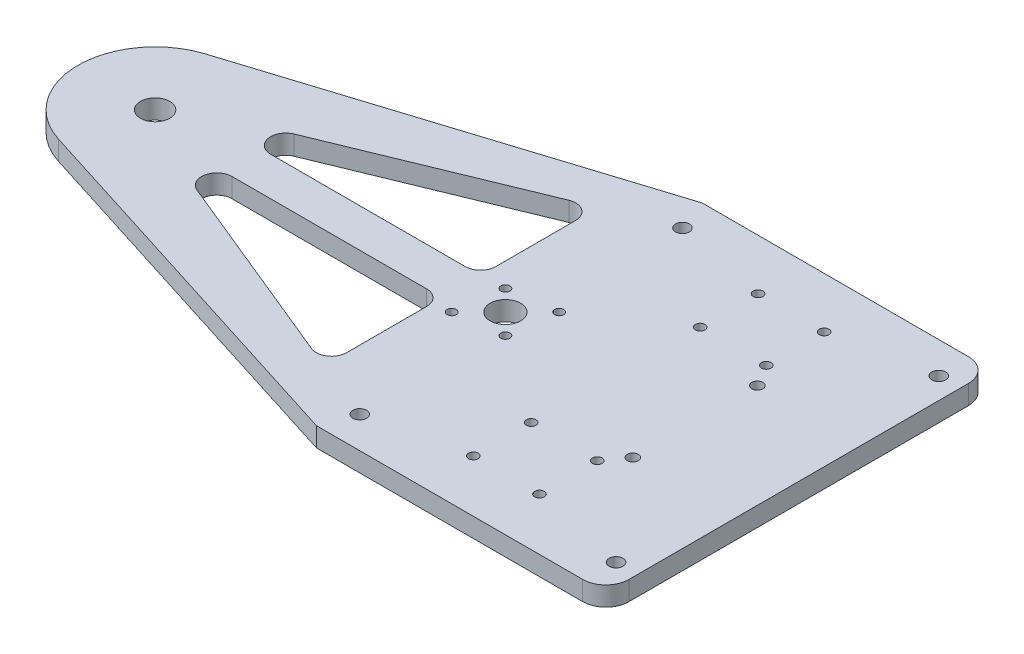
from build123d import *

# Parameters (mm, degrees)
SKETCH1_W           = 95.25
SKETCH1_H           = 127
BOSS_EXTRUDE1_DEPTH = 6.35
BOSS_EXTRUDE3_DEPTH = 6.35
SKETCH5_R           = 4.826
SKETCH5_R_2         = 5.039999953
SKETCH5_R_3         = 1.5
CUT_EXTRUDE1_DEPTH  = 201.11039673
CUT_EXTRUDE2_DEPTH  = 201.11039673
FILLET9_R           = 5
FILLET10_R          = 7.62
SKETCH7_R           = 2.2812375
CUT_EXTRUDE3_DEPTH  = 201.11039673
SKETCH8_R           = 1.5875
CUT_EXTRUDE4_DEPTH  = 201.11039673
SKETCH9_R           = 1.830008083
CUT_EXTRUDE5_DEPTH  = 201.11039673


with BuildPart() as part:
    # Sketch1 → Boss-Extrude1 (new body)
    with BuildSketch(Plane(origin=(0, 0, 0), x_dir=(1, 0, 0), z_dir=(0, 1, 0))):
        Rectangle(SKETCH1_W, SKETCH1_H)
    extrude(amount=BOSS_EXTRUDE1_DEPTH)

    # Sketch4 → Boss-Extrude3 (add)
    with BuildSketch(Plane(origin=(0, 6.35, 0), x_dir=(1, 0, 0), z_dir=(0, 1, 0))):
        with BuildLine():
            Line((-47.625, 63.5), (-171.916018217, 24.219268021))
            ThreePointArc((-171.916018217, 24.219268021), (-189.6618, 0), (-171.916018217, -24.219268021))
            Line((-171.916018217, -24.219268021), (-47.625, -63.5))
            Line((-47.625, -63.5), (-47.625, 63.5))
        make_face()
    extrude(amount=-BOSS_EXTRUDE3_DEPTH)

    # Sketch5 → Cut-Extrude1 (cut, through all)
    with BuildSketch(Plane(origin=(0, 6.35, 0), x_dir=(1, 0, 0), z_dir=(0, 1, 0))):
        with Locations((-164.2618, 0)):
            Circle(SKETCH5_R)
        with Locations((-48.9458, 0)):
            Circle(SKETCH5_R_2)
        with Locations((-42.228285579, -6.717514421)):
            Circle(SKETCH5_R_3)
        with Locations((-40.106965235, 8.838834765)):
            Circle(SKETCH5_R_3)
        with Locations((-57.784634765, -8.838834765)):
            Circle(SKETCH5_R_3)
        with Locations((-55.663314421, 6.717514421)):
            Circle(SKETCH5_R_3)
    extrude(amount=-CUT_EXTRUDE1_DEPTH, mode=Mode.SUBTRACT)

    # Sketch6 → Cut-Extrude2 (cut, through all)
    with BuildSketch(Plane(origin=(0, 6.35, 0), x_dir=(1, 0, 0), z_dir=(0, 1, 0))):
        Polygon((-63.5, 45.163743355), (-157.9118, 6.35), (-63.5, 6.35), align=None)
        Polygon((-63.5, -6.35), (-63.5, -45.163743355), (-157.9118, -6.35), align=None)
    extrude(amount=-CUT_EXTRUDE2_DEPTH, mode=Mode.SUBTRACT)

    # Fillet9
    fillet9_edges = [part.edges().sort_by_distance(p)[0] for p in [
        (-157.9118, 3.175, 6.35),
        (-63.5, 3.175, 6.35),
        (-63.5, 3.175, 45.163743355),
        (-63.5, 3.175, -6.35),
        (-157.9118, 3.175, -6.35),
        (-63.5, 3.175, -45.163743355),
    ]]
    fillet(fillet9_edges, radius=FILLET9_R)

    # Fillet10
    fillet10_edges = [part.edges().sort_by_distance(p)[0] for p in [
        (47.625, 3.175, -63.5),
        (47.625, 3.175, 63.5),
    ]]
    fillet(fillet10_edges, radius=FILLET10_R)

    # Sketch7 → Cut-Extrude3 (cut, through all)
    with BuildSketch(Plane(origin=(0, 6.35, 0), x_dir=(1, 0, 0), z_dir=(0, 1, 0))):
        with Locations((-43.777254611, -53.125383493)):
            Circle(SKETCH7_R)
        with Locations((-43.777254611, 53.125383493)):
            Circle(SKETCH7_R)
        with Locations((40.602254611, 53.125383493)):
            Circle(SKETCH7_R)
        with Locations((40.602254611, -53.125383493)):
            Circle(SKETCH7_R)
    extrude(amount=-CUT_EXTRUDE3_DEPTH, mode=Mode.SUBTRACT)

    # Sketch8 → Cut-Extrude4 (cut, through all)
    with BuildSketch(Plane(origin=(0, 6.35, 0), x_dir=(1, 0, 0), z_dir=(0, 1, 0))):
        with Locations((-13.209796215, -27.25)):
            Circle(SKETCH8_R)
        with Locations((8.564628211, -27.25)):
            Circle(SKETCH8_R)
        with Locations((8.564628211, -46.3)):
            Circle(SKETCH8_R)
        with Locations((-13.209796215, -46.3)):
            Circle(SKETCH8_R)
        with Locations((9.199628211, 46.8)):
            Circle(SKETCH8_R)
        with Locations((-12.574796215, 27.75)):
            Circle(SKETCH8_R)
        with Locations((-12.574796215, 46.8)):
            Circle(SKETCH8_R)
        with Locations((9.199628211, 27.75)):
            Circle(SKETCH8_R)
    extrude(amount=-CUT_EXTRUDE4_DEPTH, mode=Mode.SUBTRACT)

    # Sketch9 → Cut-Extrude5 (cut, through all)
    with BuildSketch(Plane(origin=(0, 6.35, 0), x_dir=(1, 0, 0), z_dir=(0, 1, 0))):
        with Locations((13.499388849, -20.49783886)):
            Circle(SKETCH9_R)
        with Locations((13.49951585, 20.502576943)):
            Circle(SKETCH9_R)
    extrude(amount=-CUT_EXTRUDE5_DEPTH, mode=Mode.SUBTRACT)


solid = part.part
